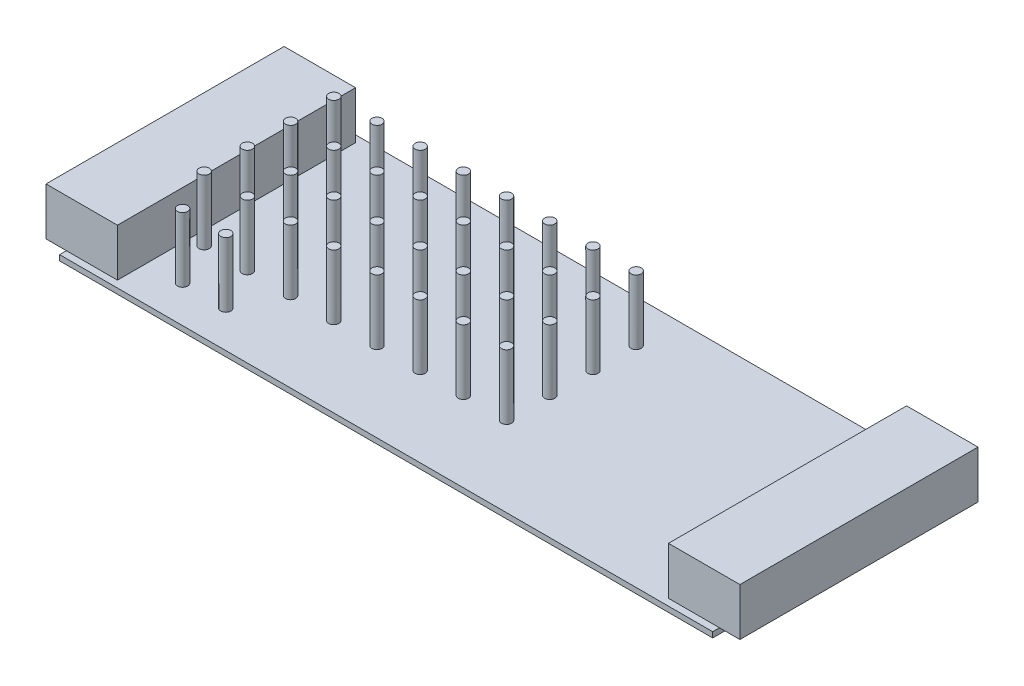
from build123d import *

# Parameters (mm, degrees)
SKETCH1_W                       = 192
SKETCH1_H                       = 74
BOSS_EXTRUDE1_DEPTH             = 1.6
BOSS_EXTRUDE2_START             = -7
SKETCH2_R                       = 1.5
BOSS_EXTRUDE2_DEPTH             = 26
LPATTERN1_COUNT                 = 8
LPATTERN1_PITCH                 = 12.7
LPATTERN1_COUNT_DIR2            = 4
LPATTERN1_PITCH_DIR2            = 12.7
BOSS_EXTRUDE3_REACH             = 106.623
SKETCH3_R                       = 1.5
BOSS_EXTRUDE3_DIRECTION_2_REACH = 106.623
SKETCH4_W                       = 21
SKETCH4_H                       = 70
BOSS_EXTRUDE4_DEPTH             = 14


with BuildPart() as part:
    # Sketch1 → Boss-Extrude1 (new body)
    with BuildSketch(Plane(origin=(0, 0, 0), x_dir=(1, 0, 0), z_dir=(0, 1, 0))):
        Rectangle(SKETCH1_W, SKETCH1_H)
    extrude(amount=BOSS_EXTRUDE1_DEPTH)

    # Sketch2 → Boss-Extrude2 (add)
    with BuildSketch(Plane(origin=(0, 1.6, 0), x_dir=(1, 0, 0), z_dir=(0, 1, 0)).offset(BOSS_EXTRUDE2_START)):
        with Locations((-77.018516416, 24.619351321)):
            Circle(SKETCH2_R)
    boss_extrude2 = extrude(amount=BOSS_EXTRUDE2_DEPTH)

    # LPattern1: Boss-Extrude2 8 × 4
    with Locations(*[(i * LPATTERN1_PITCH, 0, j * LPATTERN1_PITCH_DIR2) for i in range(LPATTERN1_COUNT) for j in range(LPATTERN1_COUNT_DIR2) if (i, j) != (0, 0)]):
        add(boss_extrude2)

    # Boss-Extrude3: up to this face of the body (flat: up to its plane)
    boss_extrude3_end = Plane(part.part.faces().sort_by_distance((-77.018516416, 20.6, 13.480648679))[0])
    # Sketch3 → Boss-Extrude3 (add, up to the picked face)
    with BuildSketch(Plane(origin=(0, 1.6, 0), x_dir=(1, 0, 0), z_dir=(0, 1, 0)), mode=Mode.PRIVATE) as boss_extrude3_sk1:
        with Locations((-70.668516416, -26.180648679)):
            Circle(SKETCH3_R)
    boss_extrude3_tool1 = split(extrude(boss_extrude3_sk1.sketch, amount=BOSS_EXTRUDE3_REACH, mode=Mode.PRIVATE), bisect_by=boss_extrude3_end, keep=Keep.BOTH, mode=Mode.PRIVATE)
    # Sketch3 → Boss-Extrude3 (add, up to the picked face)
    with BuildSketch(Plane(origin=(0, 1.6, 0), x_dir=(1, 0, 0), z_dir=(0, 1, 0)), mode=Mode.PRIVATE) as boss_extrude3_sk2:
        with Locations((-57.952396607, -26.180648679)):
            Circle(SKETCH3_R)
    boss_extrude3_tool2 = split(extrude(boss_extrude3_sk2.sketch, amount=BOSS_EXTRUDE3_REACH, mode=Mode.PRIVATE), bisect_by=boss_extrude3_end, keep=Keep.BOTH, mode=Mode.PRIVATE)
    add(boss_extrude3_tool1.solids().sort_by(Axis((-70.668516, 1.6, 26.180649), (0, 1, 0)))[0])
    add(boss_extrude3_tool2.solids().sort_by(Axis((-57.952397, 1.6, 26.180649), (0, 1, 0)))[0])

    # Boss-Extrude3 direction 2: up to this face of the body (flat: up to its plane)
    boss_extrude3_direction_2_end = Plane(part.part.faces().sort_by_distance((-77.018516416, -5.4, 13.480648679))[0])
    # Sketch3 → Boss-Extrude3 direction 2 (add, up to the picked face)
    with BuildSketch(Plane(origin=(0, 1.6, 0), x_dir=(1, 0, 0), z_dir=(0, 1, 0)), mode=Mode.PRIVATE) as boss_extrude3_direction_2_sk1:
        with Locations((-70.668516416, -26.180648679)):
            Circle(SKETCH3_R)
    boss_extrude3_direction_2_tool1 = split(extrude(boss_extrude3_direction_2_sk1.sketch, amount=-BOSS_EXTRUDE3_DIRECTION_2_REACH, mode=Mode.PRIVATE), bisect_by=boss_extrude3_direction_2_end, keep=Keep.BOTH, mode=Mode.PRIVATE)
    # Sketch3 → Boss-Extrude3 direction 2 (add, up to the picked face)
    with BuildSketch(Plane(origin=(0, 1.6, 0), x_dir=(1, 0, 0), z_dir=(0, 1, 0)), mode=Mode.PRIVATE) as boss_extrude3_direction_2_sk2:
        with Locations((-57.952396607, -26.180648679)):
            Circle(SKETCH3_R)
    boss_extrude3_direction_2_tool2 = split(extrude(boss_extrude3_direction_2_sk2.sketch, amount=-BOSS_EXTRUDE3_DIRECTION_2_REACH, mode=Mode.PRIVATE), bisect_by=boss_extrude3_direction_2_end, keep=Keep.BOTH, mode=Mode.PRIVATE)
    add(boss_extrude3_direction_2_tool1.solids().sort_by(Axis((-70.668516, 1.6, 26.180649), (0, -1, 0)))[0])
    add(boss_extrude3_direction_2_tool2.solids().sort_by(Axis((-57.952397, 1.6, 26.180649), (0, -1, 0)))[0])

    # Sketch4 → Boss-Extrude4 (add)
    with BuildSketch(Plane(origin=(0, 1.6, 0), x_dir=(1, 0, 0), z_dir=(0, 1, 0))):
        with Locations((-91.5, 0)):
            Rectangle(SKETCH4_W, SKETCH4_H)
        with Locations((91.5, 0)):
            Rectangle(SKETCH4_W, SKETCH4_H)
    extrude(amount=BOSS_EXTRUDE4_DEPTH)


solid = part.part
